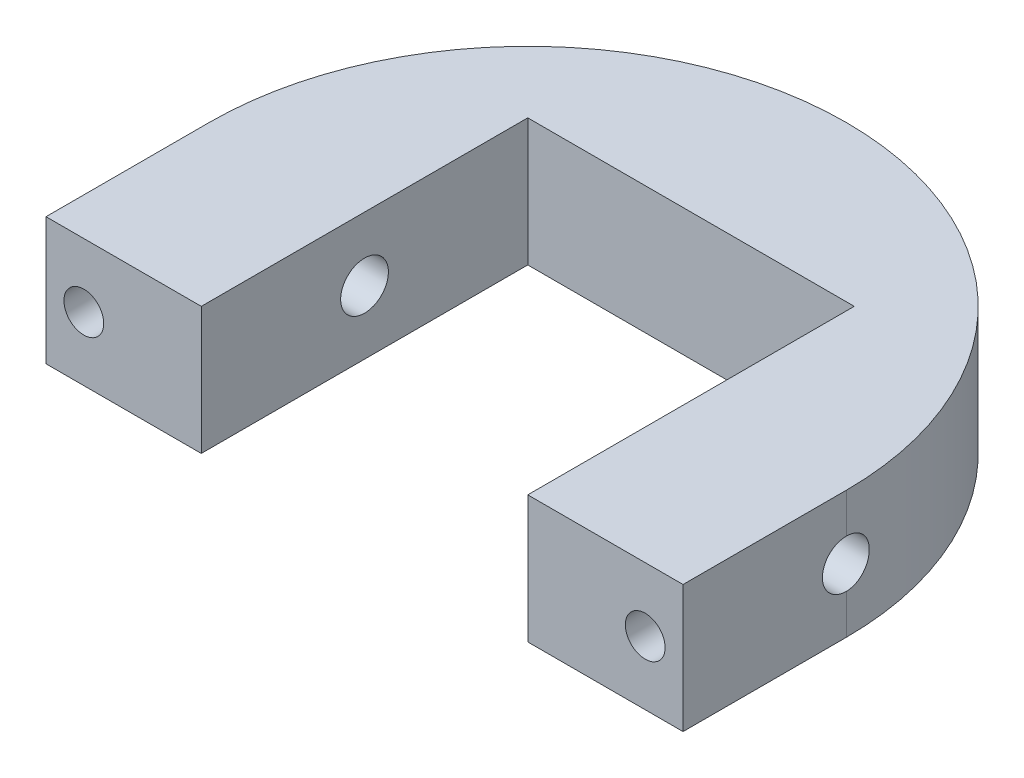
from build123d import *

# Parameters (mm, degrees)
SKETCH1_R                 = 40
BOSS_EXTRUDE1_DEPTH       = 16
SKETCH2_W                 = 41
SKETCH2_H                 = 41
CUT_EXTRUDE1_DEPTH        = 59.787753827
SKETCH13_W                = 61
SKETCH13_H                = 46
BOSS_EXTRUDE4_DEPTH       = 75
SKETCH14_W                = 49
SKETCH14_H                = 67
CUT_EXTRUDE2_DEPTH        = 35
SKETCH15_W                = 49
SKETCH15_H                = 61
CUT_EXTRUDE3_DEPTH        = 5
FILLET1_R                 = 10
FILLET2_R                 = 5
CUT_EXTRUDE5_REACH        = 110.08
SKETCH17_R                = 41
BOSS_EXTRUDE5_DEPTH       = 16
CUT_EXTRUDE4_DEPTH        = 118.224144271
CUT_EXTRUDE4_DEPTH_BACK   = 118.224144271
SKETCH16_R                = 3
F_5_0MM_DOWEL_HOLE1_D     = 5
F_5_0MM_DOWEL_HOLE1_DEPTH = 25
F_5_0MM_DOWEL_HOLE1_TIP   = 1.502151548
CUT_EXTRUDE6_DEPTH        = 109.079831643
CUT_EXTRUDE6_DEPTH_BACK   = 109.079831643
SKETCH21_W                = 80
SKETCH21_H                = 75


with BuildPart() as part:
    # Sketch1 → Boss-Extrude1 (new body)
    with BuildSketch(Plane(origin=(0, 0, 0), x_dir=(1, 0, 0), z_dir=(0, 1, 0))):
        with Locations(Location((0, 0, 0), (0, 0, 270))):
            Circle(SKETCH1_R)
    extrude(amount=BOSS_EXTRUDE1_DEPTH)

    # Sketch2 → Cut-Extrude1 (cut, through all)
    with BuildSketch(Plane(origin=(0, 16, 0), x_dir=(1, 0, 0), z_dir=(0, 1, 0))):
        Rectangle(SKETCH2_W, SKETCH2_H)
    extrude(amount=-CUT_EXTRUDE1_DEPTH, mode=Mode.SUBTRACT)

    # Sketch13 → Boss-Extrude4 (add)
    with BuildSketch(Plane(origin=(0, 0, 20.5), x_dir=(-1, 0, 0), z_dir=(0, 0, -1))):
        with Locations((0, 8)):
            Rectangle(SKETCH13_W, SKETCH13_H)
    extrude(amount=-BOSS_EXTRUDE4_DEPTH)

    # Sketch14 → Cut-Extrude2 (cut)
    with BuildSketch(Plane(origin=(0, 31, 0), x_dir=(1, 0, 0), z_dir=(0, 1, 0))):
        with Locations((0, -62)):
            Rectangle(SKETCH14_W, SKETCH14_H)
    extrude(amount=-CUT_EXTRUDE2_DEPTH, mode=Mode.SUBTRACT)

    # Sketch15 → Cut-Extrude3 (cut)
    with BuildSketch(Plane(origin=(0, -4, 0), x_dir=(1, 0, 0), z_dir=(0, 1, 0))):
        with Locations((0, -59)):
            Rectangle(SKETCH15_W, SKETCH15_H)
    extrude(amount=-CUT_EXTRUDE3_DEPTH, mode=Mode.SUBTRACT)

    # Fillet1
    fillet1_edges = [part.edges().sort_by_distance(p)[0] for p in [
        (-27.5, 31, 95.5),
        (27.5, 31, 95.5),
    ]]
    fillet(fillet1_edges, radius=FILLET1_R)

    # Fillet2
    fillet2_edges = [part.edges().sort_by_distance(p)[0] for p in [
        (0, -9, 89.5),
        (0, -15, 95.5),
        (0, -15, 20.5),
        (0, -9, 28.5),
    ]]
    fillet(fillet2_edges, radius=FILLET2_R - 0.0001)  # a hair under: the kernel refuses the full size

    # Sketch17 → Cut-Extrude5 (cut, up to next)
    with BuildSketch(Plane(origin=(0, 16, 0), x_dir=(1, 0, 0), z_dir=(0, 1, 0)), mode=Mode.PRIVATE) as cut_extrude5_sk1:
        Circle(SKETCH17_R)
    cut_extrude5_tool1 = extrude(cut_extrude5_sk1.sketch, amount=CUT_EXTRUDE5_REACH, mode=Mode.PRIVATE) & part.part
    add(cut_extrude5_tool1.solids().sort_by_distance((0, 16, 0))[0], mode=Mode.SUBTRACT)

    # Sketch18 → Boss-Extrude5 (add)
    with BuildSketch(Plane(origin=(0, 16, 0), x_dir=(1, 0, 0), z_dir=(0, 1, 0))):
        Polygon((20.5, 0), (20.5, -20.5), (-20.5, -20.5), (-20.5, 0), (-40, 0), (-40, -32.874762357), (-24.5, -32.874762357), (-24.5, -28.5), (24.5, -28.5), (24.5, -32.874762357), (40, -32.874762357), (40, 0), align=None)
    extrude(amount=-BOSS_EXTRUDE5_DEPTH)

    # Sketch16 → Cut-Extrude4 (cut, two sides: drawn at the far end of the back side and taken through both)
    with BuildSketch(Plane.ZY.offset(-20.5).offset(-CUT_EXTRUDE4_DEPTH_BACK)):
        with Locations(Location((0, 8, 0), (0, 0, 270))):
            Circle(SKETCH16_R)
    extrude(amount=CUT_EXTRUDE4_DEPTH + CUT_EXTRUDE4_DEPTH_BACK, mode=Mode.SUBTRACT)

    # Ø5.0mm Dowel Hole1
    with Locations(Plane(origin=(-35.25, 8, 32.874762357), x_dir=(1, 0, 0), z_dir=(0, 0, 1))):
        with Locations((0, 0), (70.5, 0)):
            Hole(F_5_0MM_DOWEL_HOLE1_D / 2, depth=F_5_0MM_DOWEL_HOLE1_DEPTH)
            with Locations((0, 0, -(F_5_0MM_DOWEL_HOLE1_DEPTH + F_5_0MM_DOWEL_HOLE1_TIP / 2))):  # 118° drill point
                Cone(0, F_5_0MM_DOWEL_HOLE1_D / 2, F_5_0MM_DOWEL_HOLE1_TIP, mode=Mode.SUBTRACT)

    # Sketch21 → Cut-Extrude6 (cut, two sides: drawn at the far end of the back side and taken through both)
    with BuildSketch(Plane(origin=(0, 16, 0), x_dir=(1, 0, 0), z_dir=(0, 1, 0)).offset(-CUT_EXTRUDE6_DEPTH_BACK)):
        with Locations((0, -58)):
            Rectangle(SKETCH21_W, SKETCH21_H)
    extrude(amount=CUT_EXTRUDE6_DEPTH + CUT_EXTRUDE6_DEPTH_BACK, mode=Mode.SUBTRACT)


solid = part.part
